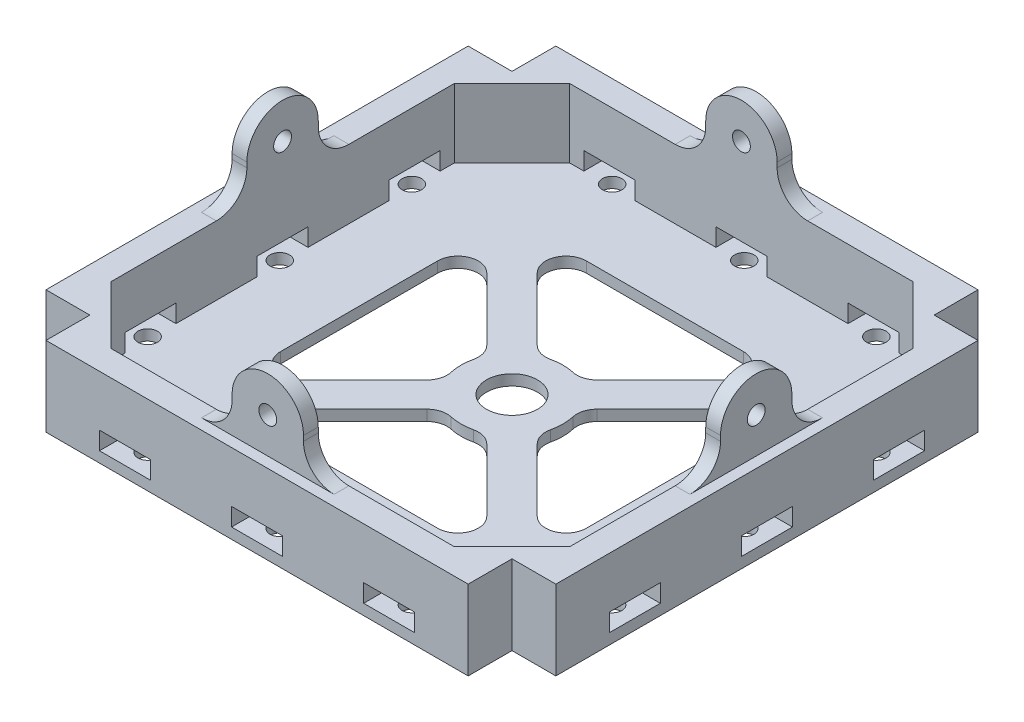
from build123d import *

# Parameters (mm, degrees)
SKETCH1_R              = 5
BOSS_EXTRUDE1_DEPTH    = 2.1
BOSS_EXTRUDE2_DEPTH    = 13.5
CUT_EXTRUDE2_START     = -0.5
CUT_EXTRUDE2_OUTLINE_W = 2.116666667
CUT_EXTRUDE2_OUTLINE_H = 1.838157895
CUT_EXTRUDE2_DEPTH     = 0.5
SKETCH5_R              = 1.75
BOSS_EXTRUDE3_DEPTH    = 2.9
CIRPATTERN37_COUNT     = 4
SKETCH6_R              = 1.905
CUT_EXTRUDE3_DEPTH     = 4
CUT_EXTRUDE4_DEPTH     = 10
CIRPATTERN39_COUNT     = 4


# Read off the part's stored shape, not the designer's step: Cut-Extrude2
with BuildPart() as part:
    # Sketch1 → Boss-Extrude1 (new body)
    with BuildSketch(Plane(origin=(0, 0, 0), x_dir=(1, 0, 0), z_dir=(0, 1, 0))):
        Polygon((-50, 41.4), (-50, -41.4), (-41.4, -41.4), (-41.4, -50), (41.4, -50), (41.4, -41.4), (50, -41.4), (50, 41.4), (41.4, 41.4), (41.4, 50), (-41.4, 50), (-41.4, 41.4), align=None)
        with BuildLine():
            ThreePointArc((-15.393398282, -30), (-19.088916412, -27.530733729), (-18.221825407, -23.171572875))
            Line((-18.221825407, -23.171572875), (-5.884253014, -10.834000483))
            ThreePointArc((-5.884253014, -10.834000483), (-4.171534398, -9.821178524), (-2.182732778, -9.758876863))
            ThreePointArc((-2.182732778, -9.758876863), (0, -10), (2.182732778, -9.758876863))
            ThreePointArc((2.182732778, -9.758876863), (4.171534398, -9.821178524), (5.884253014, -10.834000483))
            Line((5.884253014, -10.834000483), (18.221825407, -23.171572875))
            ThreePointArc((18.221825407, -23.171572875), (19.088916412, -27.530733729), (15.393398282, -30))
            Line((15.393398282, -30), (-15.393398282, -30))
        make_face(mode=Mode.SUBTRACT)
        with BuildLine():
            Line((-10.834000483, -5.884253014), (-23.171572875, -18.221825407))
            ThreePointArc((-23.171572875, -18.221825407), (-27.530733729, -19.088916412), (-30, -15.393398282))
            Line((-30, -15.393398282), (-30, 15.393398282))
            ThreePointArc((-30, 15.393398282), (-27.530733729, 19.088916412), (-23.171572875, 18.221825407))
            Line((-23.171572875, 18.221825407), (-10.834000483, 5.884253014))
            ThreePointArc((-10.834000483, 5.884253014), (-9.821178524, 4.171534398), (-9.758876863, 2.182732778))
            ThreePointArc((-9.758876863, 2.182732778), (-10, 0), (-9.758876863, -2.182732778))
            ThreePointArc((-9.758876863, -2.182732778), (-9.821178524, -4.171534398), (-10.834000483, -5.884253014))
        make_face(mode=Mode.SUBTRACT)
        with Locations(Location((0, 0, 0), (0, 0, 270))):
            Circle(SKETCH1_R, mode=Mode.SUBTRACT)
        with BuildLine():
            ThreePointArc((30, -15.393398282), (27.530733729, -19.088916412), (23.171572875, -18.221825407))
            Line((23.171572875, -18.221825407), (10.834000483, -5.884253014))
            ThreePointArc((10.834000483, -5.884253014), (9.821178524, -4.171534398), (9.758876863, -2.182732778))
            ThreePointArc((9.758876863, -2.182732778), (10, 0), (9.758876863, 2.182732778))
            ThreePointArc((9.758876863, 2.182732778), (9.821178524, 4.171534398), (10.834000483, 5.884253014))
            Line((10.834000483, 5.884253014), (23.171572875, 18.221825407))
            ThreePointArc((23.171572875, 18.221825407), (27.530733729, 19.088916412), (30, 15.393398282))
            Line((30, 15.393398282), (30, -15.393398282))
        make_face(mode=Mode.SUBTRACT)
        with BuildLine():
            Line((-5.884253014, 10.834000483), (-18.221825407, 23.171572875))
            ThreePointArc((-18.221825407, 23.171572875), (-19.088916412, 27.530733729), (-15.393398282, 30))
            Line((-15.393398282, 30), (15.393398282, 30))
            ThreePointArc((15.393398282, 30), (19.088916412, 27.530733729), (18.221825407, 23.171572875))
            Line((18.221825407, 23.171572875), (5.884253014, 10.834000483))
            ThreePointArc((5.884253014, 10.834000483), (4.171534398, 9.821178524), (2.182732778, 9.758876863))
            ThreePointArc((2.182732778, 9.758876863), (0, 10), (-2.182732778, 9.758876863))
            ThreePointArc((-2.182732778, 9.758876863), (-4.171534398, 9.821178524), (-5.884253014, 10.834000483))
        make_face(mode=Mode.SUBTRACT)
    extrude(amount=BOSS_EXTRUDE1_DEPTH)

    # Sketch2 → Boss-Extrude2 (add)
    with BuildSketch(Plane(origin=(0, 2.1, 0), x_dir=(1, 0, 0), z_dir=(0, 1, 0))):
        Polygon((-50, -41.4), (-41.4, -41.4), (-41.4, -50), (41.4, -50), (41.4, -41.4), (50, -41.4), (50, 41.4), (41.4, 41.4), (41.4, 50), (-41.4, 50), (-41.4, 41.4), (-50, 41.4), align=None)
        Polygon((-45, 33.686291501), (-45, -33.686291501), (-33.686291501, -45), (33.686291501, -45), (45, -33.686291501), (45, 33.686291501), (33.686291501, 45), (-33.686291501, 45), align=None, mode=Mode.SUBTRACT)
    extrude(amount=BOSS_EXTRUDE2_DEPTH)

    # Cut-Extrude2 outline → Cut-Extrude2 (cut)
    # profile 1 of 17: a face of its own
    with BuildSketch(Plane.XZ.offset(CUT_EXTRUDE2_START)):
        with BuildLine():
            add(Edge.make_bspline(
                [(40.707536165, 36.609129994), (40.742948557, 36.608681903), (40.811254877, 36.60781759), (40.910038544, 36.599727141), (41.00156458, 36.587480132), (41.085368307, 36.567654857), (41.162507675, 36.545144743), (41.231276113, 36.515075245), (41.293413313, 36.481278083), (41.347685137, 36.440921464), (41.394891306, 36.395189708), (41.436326199, 36.345164309), (41.471564766, 36.290098143), (41.49903923, 36.229111498), (41.522142744, 36.1637993), (41.537600516, 36.092767422), (41.545930404, 36.016919254), (41.54748678, 35.964808143), (41.54828452, 35.938097921)],
                knots=[0, 0, 0, 0, 0.086130676, 0.166135897, 0.240994725, 0.31050558, 0.375471466, 0.436172288, 0.492726909, 0.547213532, 0.600123186, 0.652264686, 0.704933723, 0.758614456, 0.81463812, 0.873200502, 0.935007284, 1, 1, 1, 1], degree=3))
            Line((40.707536165, 36.609129994), (38.094775748, 36.609129994))
            Line((38.094775748, 36.609129994), (38.094775748, 33.434129994))
            Line((38.094775748, 33.434129994), (38.986003819, 33.434129994))
            Line((38.986003819, 33.434129994), (38.986003819, 34.603866836))
            Line((38.986003819, 34.603866836), (39.515170485, 34.603866836))
            Line((39.515170485, 34.603866836), (40.728424323, 33.434129994))
            Line((40.728424323, 33.434129994), (41.868569608, 33.434129994))
            Line((41.868569608, 33.434129994), (40.436860452, 34.603866836))
            Line((40.436860452, 34.603866836), (40.707536165, 34.603866836))
            add(Edge.make_bspline(
                [(41.54828452, 35.280120948), (41.547477184, 35.253414311), (41.545902086, 35.201310193), (41.537705014, 35.125412414), (41.521800417, 35.054646363), (41.50025056, 34.988442683), (41.471168269, 34.927793741), (41.437400421, 34.871068229), (41.395942582, 34.820550924), (41.348613119, 34.774582115), (41.293787261, 34.734624044), (41.232707847, 34.69837418), (41.163519698, 34.669086682), (41.08664814, 34.645792608), (41.002595316, 34.626836307), (40.910726092, 34.612841236), (40.811524997, 34.605318571), (40.742942037, 34.604361119), (40.707536165, 34.603866836)],
                knots=[0, 0, 0, 0, 0.064798019, 0.126419647, 0.184806595, 0.240435923, 0.294891323, 0.347628395, 0.400158507, 0.45290966, 0.507233058, 0.564316447, 0.624835429, 0.68893432, 0.758923, 0.833660334, 0.914127344, 1, 1, 1, 1], degree=3))
            Line((41.54828452, 35.280120948), (41.54828452, 35.938097921))
        make_face()
        with BuildLine():
            add(Edge.make_bspline(
                [(40.65705645, 35.776214698), (40.656737125, 35.790777229), (40.656148762, 35.817609025), (40.647454631, 35.854420934), (40.632927735, 35.884366884), (40.609805217, 35.907462899), (40.576630571, 35.923224366), (40.531780225, 35.934069894), (40.473226695, 35.938993618), (40.429610834, 35.940098743), (40.405528215, 35.940708941)],
                knots=[0, 0, 0, 0, 0.123742076, 0.227997588, 0.319702305, 0.403550421, 0.500778739, 0.628405384, 0.794823007, 1, 1, 1, 1], degree=3))
            Line((40.65705645, 35.776214698), (40.65705645, 35.439393152))
            add(Edge.make_bspline(
                [(40.405528215, 35.272287889), (40.429593671, 35.272938271), (40.47346666, 35.274123964), (40.532495661, 35.278655651), (40.57706232, 35.290215419), (40.611260333, 35.304188234), (40.632525866, 35.329021557), (40.647914037, 35.358939993), (40.655957041, 35.396934649), (40.656672598, 35.424568996), (40.65705645, 35.439393152)],
                knots=[0, 0, 0, 0, 0.203407819, 0.370826509, 0.497352672, 0.592647424, 0.675844671, 0.766758648, 0.874880125, 1, 1, 1, 1], degree=3))
            Line((40.405528215, 35.272287889), (38.986003819, 35.272287889))
            Line((38.986003819, 35.272287889), (38.986003819, 35.940708941))
            Line((38.986003819, 35.940708941), (40.405528215, 35.940708941))
        make_face(mode=Mode.SUBTRACT)
    # profile 2 of 17: a face of its own
    with BuildSketch(Plane.XZ.offset(CUT_EXTRUDE2_START)):
        with BuildLine():
            add(Edge.make_bspline(
                [(27.729027393, 36.609129994), (27.764439798, 36.608681916), (27.832746141, 36.607817626), (27.931529644, 36.599727012), (28.023056242, 36.587480568), (28.106858081, 36.567653396), (28.184003812, 36.545149673), (28.252750804, 36.515058636), (28.31496084, 36.481334628), (28.368816271, 36.440841641), (28.416977702, 36.396038427), (28.457517698, 36.345188371), (28.492860337, 36.29031783), (28.520737096, 36.22978314), (28.543605582, 36.16465604), (28.559015396, 36.093921461), (28.567471188, 36.018375472), (28.568991936, 35.966550072), (28.569775748, 35.939838601)],
                knots=[0, 0, 0, 0, 0.086241168, 0.166349021, 0.241303881, 0.310903906, 0.375953133, 0.436731824, 0.493358995, 0.547915515, 0.600405328, 0.653160866, 0.705897468, 0.759006805, 0.815102337, 0.873739845, 0.934923909, 1, 1, 1, 1], degree=3))
            Line((27.729027393, 36.609129994), (25.116266976, 36.609129994))
            Line((25.116266976, 36.609129994), (25.116266976, 33.434129994))
            Line((25.116266976, 33.434129994), (26.007495047, 33.434129994))
            Line((26.007495047, 33.434129994), (26.007495047, 34.65956859))
            Line((26.007495047, 34.65956859), (27.729027393, 34.65956859))
            add(Edge.make_bspline(
                [(28.569775748, 35.328859983), (28.568982444, 35.302152092), (28.567443282, 35.250333639), (28.559117487, 35.174738612), (28.543266948, 35.104269269), (28.521928984, 35.038252548), (28.492627162, 34.978269717), (28.458919527, 34.922342144), (28.417116682, 34.872761768), (28.370385718, 34.826731611), (28.315188574, 34.787763525), (28.254167574, 34.752292545), (28.18458069, 34.723905754), (28.107783283, 34.700928872), (28.023909903, 34.681256661), (27.932119263, 34.66890516), (27.833031732, 34.660918741), (27.764438545, 34.660028286), (27.729027393, 34.65956859)],
                knots=[0, 0, 0, 0, 0.065034673, 0.126179797, 0.184779985, 0.240612481, 0.294628799, 0.346956687, 0.399131849, 0.452075659, 0.506179624, 0.563117822, 0.623582121, 0.688589947, 0.758145676, 0.83305283, 0.913813721, 1, 1, 1, 1], degree=3))
            Line((28.569775748, 35.328859983), (28.569775748, 35.939838601))
        make_face()
        with BuildLine():
            add(Edge.make_bspline(
                [(27.678547678, 35.781436737), (27.678241829, 35.795423283), (27.677679937, 35.821118676), (27.668827883, 35.856479513), (27.654161527, 35.885395324), (27.631305844, 35.908285468), (27.597987551, 35.924489422), (27.552710568, 35.933196994), (27.494568901, 35.940669701), (27.45113763, 35.940694931), (27.427019444, 35.940708941)],
                knots=[0, 0, 0, 0, 0.120297595, 0.221004821, 0.31164098, 0.396538571, 0.494983838, 0.626034827, 0.792330237, 1, 1, 1, 1], degree=3))
            Line((27.678547678, 35.781436737), (27.678547678, 35.489872867))
            add(Edge.make_bspline(
                [(27.427019444, 35.327989643), (27.451118203, 35.328077531), (27.495090919, 35.328237899), (27.553729926, 35.335039572), (27.598742953, 35.344756521), (27.632372322, 35.359136512), (27.654323364, 35.382979756), (27.669004633, 35.412471874), (27.677557158, 35.44908462), (27.6782013, 35.475609514), (27.678547678, 35.489872867)],
                knots=[0, 0, 0, 0, 0.205770203, 0.375466415, 0.502907386, 0.599343852, 0.681731003, 0.773734207, 0.878329059, 1, 1, 1, 1], degree=3))
            Line((27.427019444, 35.327989643), (26.007495047, 35.327989643))
            Line((26.007495047, 35.327989643), (26.007495047, 35.940708941))
            Line((26.007495047, 35.940708941), (27.427019444, 35.940708941))
        make_face(mode=Mode.SUBTRACT)
    # profile 3 of 17: a face of its own
    with BuildSketch(Plane.XZ.offset(CUT_EXTRUDE2_START)):
        with BuildLine():
            add(Edge.make_bspline(
                [(17.325854422, 36.609129994), (17.39754872, 36.607693096), (17.536850055, 36.604901218), (17.739462875, 36.58622298), (17.928991739, 36.552701165), (18.106255703, 36.508588584), (18.270220582, 36.448832077), (18.421241268, 36.37657842), (18.560269514, 36.292098822), (18.684824616, 36.193329382), (18.795592856, 36.083192421), (18.893023146, 35.963814195), (18.974744528, 35.83366212), (19.040430623, 35.69363776), (19.093776055, 35.544676766), (19.129209266, 35.385011661), (19.152908, 35.216138217), (19.155073634, 35.100046076), (19.156179257, 35.040777472)],
                knots=[0, 0, 0, 0, 0.078637394, 0.152791702, 0.222892515, 0.289573351, 0.352889383, 0.413946259, 0.472940987, 0.530936077, 0.587862435, 0.643969151, 0.699589206, 0.755953396, 0.813318286, 0.872753321, 0.935036661, 1, 1, 1, 1], degree=3))
            Line((17.325854422, 36.609129994), (15.312758204, 36.609129994))
            Line((15.312758204, 36.609129994), (15.312758204, 33.434129994))
            Line((15.312758204, 33.434129994), (17.1465644, 33.434129994))
            add(Edge.make_bspline(
                [(18.439889509, 33.679565849), (18.405452123, 33.659688466), (18.333605384, 33.618218268), (18.213254679, 33.568140977), (18.077957459, 33.52738333), (17.927766035, 33.492192171), (17.760288305, 33.46523272), (17.5732943, 33.448412156), (17.366653478, 33.435291206), (17.222018551, 33.434528098), (17.1465644, 33.434129994)],
                knots=[0, 0, 0, 0, 0.089478027, 0.186678065, 0.292692126, 0.407430982, 0.533853899, 0.674342509, 0.830108744, 1, 1, 1, 1], degree=3))
            add(Edge.make_bspline(
                [(19.156179257, 35.040777472), (19.153990895, 34.970731636), (19.14967987, 34.832742843), (19.11602404, 34.630750861), (19.060058291, 34.43814651), (18.994433379, 34.286363358), (18.93203305, 34.170797873), (18.878455869, 34.088676886), (18.81943018, 34.01043218), (18.75452897, 33.93632445), (18.685042553, 33.865352991), (18.608687803, 33.799281545), (18.527262114, 33.736400933), (18.469172992, 33.698614488), (18.439889509, 33.679565849)],
                knots=[0, 0, 0, 0, 0.130485059, 0.257052765, 0.380406524, 0.503432845, 0.564401295, 0.624984992, 0.685970219, 0.746900303, 0.808450873, 0.870906577, 0.934922325, 1, 1, 1, 1], degree=3))
        make_face()
        with BuildLine():
            add(Edge.make_bspline(
                [(18.264951187, 35.037296112), (18.264407797, 35.073593687), (18.263352925, 35.14405738), (18.251649755, 35.246187678), (18.233598534, 35.341403865), (18.208709181, 35.429987451), (18.175342014, 35.511236361), (18.135407569, 35.586080583), (18.087103034, 35.65335335), (18.031980535, 35.71394176), (17.969292688, 35.767494915), (17.899759189, 35.814707583), (17.822309709, 35.853681248), (17.738233287, 35.886433773), (17.646308249, 35.909880653), (17.547859126, 35.928629516), (17.442111916, 35.938769446), (17.369390761, 35.940049727), (17.331946801, 35.940708941)],
                knots=[0, 0, 0, 0, 0.073130483, 0.141966615, 0.206875894, 0.26832139, 0.327067122, 0.38358201, 0.438913801, 0.493549098, 0.548284436, 0.604723646, 0.662518775, 0.722679299, 0.786223035, 0.853430512, 0.924531698, 1, 1, 1, 1], degree=3))
            add(Edge.make_bspline(
                [(16.995995595, 34.102551046), (17.05258854, 34.103128493), (17.161236562, 34.104237082), (17.317744408, 34.115143149), (17.461112264, 34.130848868), (17.591449045, 34.154187739), (17.708606884, 34.184256237), (17.812449459, 34.221379825), (17.903505121, 34.264974288), (17.982301687, 34.315727268), (18.050032862, 34.375325113), (18.107372807, 34.443813438), (18.157168379, 34.520679948), (18.196782947, 34.606965735), (18.22704273, 34.70239674), (18.249784839, 34.806035514), (18.262595581, 34.91889865), (18.264148242, 34.996938477), (18.264951187, 35.037296112)],
                knots=[0, 0, 0, 0, 0.09295946, 0.178465026, 0.257626158, 0.32979831, 0.395807325, 0.45611371, 0.510683517, 0.561314739, 0.609603616, 0.658302373, 0.707615321, 0.759644995, 0.813754958, 0.871810098, 0.933707679, 1, 1, 1, 1], degree=3))
            Line((16.995995595, 34.102551046), (16.203986275, 34.102551046))
            Line((16.203986275, 34.102551046), (16.203986275, 35.940708941))
            Line((16.203986275, 35.940708941), (17.331946801, 35.940708941))
        make_face(mode=Mode.SUBTRACT)
    # profile 4 of 17: a face of its own
    with BuildSketch(Plane.XZ.offset(CUT_EXTRUDE2_START)):
        with BuildLine():
            add(Edge.make_bspline(
                [(-3.050543605, 34.790119577), (-3.028511607, 34.772404298), (-2.986389065, 34.738534805), (-2.926056525, 34.690519349), (-2.874901199, 34.645467975), (-2.843068805, 34.617467878), (-2.829035626, 34.604155544)],
                knots=[0, 0, 0, 0, 0.187363526, 0.358216641, 0.51086774, 0.639064081, 0.639064081, 0.639064081, 0.639064081], degree=3))
            Line((-3.050543605, 34.790119577), (-5.250762903, 36.609129994))
            Line((-5.250762903, 36.609129994), (-5.853908462, 36.609129994))
            Line((-5.853908462, 36.609129994), (-5.853908462, 33.434129994))
            Line((-5.853908462, 33.434129994), (-5.074083901, 33.434129994))
            Line((-5.074083901, 33.434129994), (-5.074083901, 35.145218261))
            add(Edge.make_bspline(
                [(-5.086185599, 35.424799165), (-5.08493275, 35.405014686), (-5.081797661, 35.345740488), (-5.076155437, 35.252629157), (-5.074738715, 35.179170914), (-5.074083901, 35.145218261)],
                knots=[0.352120927, 0.352120927, 0.352120927, 0.352120927, 0.489787436, 0.764177995, 1, 1, 1, 1], degree=3))
            add(Edge.make_bspline(
                [(-4.988790589, 35.339304062), (-5.01523155, 35.362641447), (-5.047773118, 35.391363366), (-5.080129973, 35.419502188), (-5.086185599, 35.424799165)],
                knots=[0, 0, 0, 0, 0.310608346, 0.382273666, 0.382273666, 0.382273666, 0.382273666], degree=3))
            Line((-4.988790589, 35.339304062), (-2.691963561, 33.434129994))
            Line((-2.691963561, 33.434129994), (-2.066189164, 33.434129994))
            Line((-2.066189164, 33.434129994), (-2.066189164, 36.609129994))
            Line((-2.066189164, 36.609129994), (-2.846013725, 36.609129994))
            Line((-2.846013725, 36.609129994), (-2.846013725, 34.945040082))
            add(Edge.make_bspline(
                [(-2.829035626, 34.604155544), (-2.830053816, 34.617984649), (-2.832788407, 34.655605168), (-2.837224925, 34.712915435), (-2.841739089, 34.78862502), (-2.844184793, 34.86466555), (-2.845465785, 34.9209602), (-2.846013725, 34.945040082)],
                knots=[0.28303234, 0.28303234, 0.28303234, 0.28303234, 0.370401488, 0.520692291, 0.645206251, 0.848237946, 1, 1, 1, 1], degree=3))
        make_face()
    # profile 5 of 17: a face of its own
    with BuildSketch(Plane.XZ.offset(CUT_EXTRUDE2_START)):
        with BuildLine():
            add(Edge.make_bspline(
                [(-12.431937519, 36.609129994), (-12.396525115, 36.608681916), (-12.328218771, 36.607817626), (-12.229435268, 36.599727012), (-12.13790867, 36.587480568), (-12.054106832, 36.567653396), (-11.976961101, 36.545149673), (-11.908214109, 36.515058636), (-11.846004072, 36.481334628), (-11.792148642, 36.440841641), (-11.743987211, 36.396038427), (-11.703447214, 36.345188371), (-11.668104575, 36.29031783), (-11.640227816, 36.22978314), (-11.61735933, 36.16465604), (-11.601949516, 36.093921461), (-11.593493724, 36.018375472), (-11.591972977, 35.966550072), (-11.591189164, 35.939838601)],
                knots=[0, 0, 0, 0, 0.086241168, 0.166349021, 0.241303881, 0.310903906, 0.375953133, 0.436731824, 0.493358995, 0.547915515, 0.600405328, 0.653160866, 0.705897468, 0.759006805, 0.815102337, 0.873739845, 0.934923909, 1, 1, 1, 1], degree=3))
            Line((-12.431937519, 36.609129994), (-15.044697936, 36.609129994))
            Line((-15.044697936, 36.609129994), (-15.044697936, 33.434129994))
            Line((-15.044697936, 33.434129994), (-14.153469866, 33.434129994))
            Line((-14.153469866, 33.434129994), (-14.153469866, 34.65956859))
            Line((-14.153469866, 34.65956859), (-12.431937519, 34.65956859))
            add(Edge.make_bspline(
                [(-11.591189164, 35.328859983), (-11.591982468, 35.302152092), (-11.593521631, 35.250333639), (-11.601847425, 35.174738612), (-11.617697964, 35.104269269), (-11.639035928, 35.038252548), (-11.66833775, 34.978269717), (-11.702045385, 34.922342144), (-11.74384823, 34.872761768), (-11.790579194, 34.826731611), (-11.845776339, 34.787763525), (-11.906797339, 34.752292545), (-11.976384222, 34.723905754), (-12.053181629, 34.700928872), (-12.137055009, 34.681256661), (-12.228845649, 34.66890516), (-12.327933181, 34.660918741), (-12.396526368, 34.660028286), (-12.431937519, 34.65956859)],
                knots=[0, 0, 0, 0, 0.065034673, 0.126179797, 0.184779985, 0.240612481, 0.294628799, 0.346956687, 0.399131849, 0.452075659, 0.506179624, 0.563117822, 0.623582121, 0.688589947, 0.758145676, 0.83305283, 0.913813721, 1, 1, 1, 1], degree=3))
            Line((-11.591189164, 35.328859983), (-11.591189164, 35.939838601))
        make_face()
        with BuildLine():
            add(Edge.make_bspline(
                [(-12.482417234, 35.781436737), (-12.482723084, 35.795423283), (-12.483284975, 35.821118676), (-12.49213703, 35.856479513), (-12.506803385, 35.885395324), (-12.529659069, 35.908285468), (-12.562977361, 35.924489422), (-12.608254344, 35.933196994), (-12.666396011, 35.940669701), (-12.709827282, 35.940694931), (-12.733945469, 35.940708941)],
                knots=[0, 0, 0, 0, 0.120297595, 0.221004821, 0.31164098, 0.396538571, 0.494983838, 0.626034827, 0.792330237, 1, 1, 1, 1], degree=3))
            Line((-12.482417234, 35.781436737), (-12.482417234, 35.489872867))
            add(Edge.make_bspline(
                [(-12.733945469, 35.327989643), (-12.709846709, 35.328077531), (-12.665873993, 35.328237899), (-12.607234986, 35.335039572), (-12.562221959, 35.344756521), (-12.52859259, 35.359136512), (-12.506641549, 35.382979756), (-12.49196028, 35.412471874), (-12.483407755, 35.44908462), (-12.482763612, 35.475609514), (-12.482417234, 35.489872867)],
                knots=[0, 0, 0, 0, 0.205770203, 0.375466415, 0.502907386, 0.599343852, 0.681731003, 0.773734207, 0.878329059, 1, 1, 1, 1], degree=3))
            Line((-12.733945469, 35.327989643), (-14.153469866, 35.327989643))
            Line((-14.153469866, 35.327989643), (-14.153469866, 35.940708941))
            Line((-14.153469866, 35.940708941), (-12.733945469, 35.940708941))
        make_face(mode=Mode.SUBTRACT)
    # profile 6 of 17: a face of its own
    with BuildSketch(Plane.XZ.offset(CUT_EXTRUDE2_START)):
        with BuildLine():
            add(Edge.make_bspline(
                [(-19.728867344, 36.609129994), (-19.693454951, 36.608681903), (-19.625148631, 36.60781759), (-19.526364964, 36.599727141), (-19.434838929, 36.587480132), (-19.351035202, 36.567654857), (-19.273895834, 36.545144743), (-19.205127396, 36.515075245), (-19.142990196, 36.481278083), (-19.088718372, 36.440921464), (-19.041512203, 36.395189708), (-19.00007731, 36.345164309), (-18.964838742, 36.290098143), (-18.937364279, 36.229111498), (-18.914260764, 36.1637993), (-18.898802992, 36.092767422), (-18.890473105, 36.016919254), (-18.888916729, 35.964808143), (-18.888118989, 35.938097921)],
                knots=[0, 0, 0, 0, 0.086130676, 0.166135897, 0.240994725, 0.31050558, 0.375471466, 0.436172288, 0.492726909, 0.547213532, 0.600123186, 0.652264686, 0.704933723, 0.758614456, 0.81463812, 0.873200502, 0.935007284, 1, 1, 1, 1], degree=3))
            Line((-19.728867344, 36.609129994), (-22.34162776, 36.609129994))
            Line((-22.34162776, 36.609129994), (-22.34162776, 33.434129994))
            Line((-22.34162776, 33.434129994), (-21.45039969, 33.434129994))
            Line((-21.45039969, 33.434129994), (-21.45039969, 34.603866836))
            Line((-21.45039969, 34.603866836), (-20.921233024, 34.603866836))
            Line((-20.921233024, 34.603866836), (-19.707979186, 33.434129994))
            Line((-19.707979186, 33.434129994), (-18.567833901, 33.434129994))
            Line((-18.567833901, 33.434129994), (-19.999543056, 34.603866836))
            Line((-19.999543056, 34.603866836), (-19.728867344, 34.603866836))
            add(Edge.make_bspline(
                [(-18.888118989, 35.280120948), (-18.888926325, 35.253414311), (-18.890501422, 35.201310193), (-18.898698495, 35.125412414), (-18.914603092, 35.054646363), (-18.936152949, 34.988442683), (-18.96523524, 34.927793741), (-18.999003088, 34.871068229), (-19.040460927, 34.820550924), (-19.08779039, 34.774582115), (-19.142616248, 34.734624044), (-19.203695662, 34.69837418), (-19.272883811, 34.669086682), (-19.349755369, 34.645792608), (-19.433808193, 34.626836307), (-19.525677417, 34.612841236), (-19.624878511, 34.605318571), (-19.693461472, 34.604361119), (-19.728867344, 34.603866836)],
                knots=[0, 0, 0, 0, 0.064798019, 0.126419647, 0.184806595, 0.240435923, 0.294891323, 0.347628395, 0.400158507, 0.45290966, 0.507233058, 0.564316447, 0.624835429, 0.68893432, 0.758923, 0.833660334, 0.914127344, 1, 1, 1, 1], degree=3))
            Line((-18.888118989, 35.280120948), (-18.888118989, 35.938097921))
        make_face()
        with BuildLine():
            add(Edge.make_bspline(
                [(-19.779347059, 35.776214698), (-19.779666383, 35.790777229), (-19.780254746, 35.817609025), (-19.788948877, 35.854420934), (-19.803475774, 35.884366884), (-19.826598292, 35.907462899), (-19.859772938, 35.923224366), (-19.904623284, 35.934069894), (-19.963176814, 35.938993618), (-20.006792675, 35.940098743), (-20.030875293, 35.940708941)],
                knots=[0, 0, 0, 0, 0.123742076, 0.227997588, 0.319702305, 0.403550421, 0.500778739, 0.628405384, 0.794823007, 1, 1, 1, 1], degree=3))
            Line((-19.779347059, 35.776214698), (-19.779347059, 35.439393152))
            add(Edge.make_bspline(
                [(-20.030875293, 35.272287889), (-20.006809838, 35.272938271), (-19.962936849, 35.274123964), (-19.903907848, 35.278655651), (-19.859341189, 35.290215419), (-19.825143176, 35.304188234), (-19.803877643, 35.329021557), (-19.788489472, 35.358939993), (-19.780446467, 35.396934649), (-19.779730911, 35.424568996), (-19.779347059, 35.439393152)],
                knots=[0, 0, 0, 0, 0.203407819, 0.370826509, 0.497352672, 0.592647424, 0.675844671, 0.766758648, 0.874880125, 1, 1, 1, 1], degree=3))
            Line((-20.030875293, 35.272287889), (-21.45039969, 35.272287889))
            Line((-21.45039969, 35.272287889), (-21.45039969, 35.940708941))
            Line((-21.45039969, 35.940708941), (-20.030875293, 35.940708941))
        make_face(mode=Mode.SUBTRACT)
    # profile 7 of 17: a face of its own
    with BuildSketch(Plane.XZ.offset(CUT_EXTRUDE2_START)):
        with BuildLine():
            add(Edge.make_bspline(
                [(-36.601276883, 35.818861353), (-36.600937383, 35.854570874), (-36.600284859, 35.92320512), (-36.59084536, 36.021926629), (-36.578651712, 36.11254583), (-36.559969905, 36.194639616), (-36.534109799, 36.267427296), (-36.504990361, 36.332802382), (-36.469466097, 36.38951763), (-36.427507152, 36.438405162), (-36.377059109, 36.478707467), (-36.319176008, 36.515280632), (-36.250642974, 36.543871013), (-36.173865893, 36.568563726), (-36.087387223, 36.586111226), (-35.992152611, 36.600255918), (-35.887135299, 36.607709253), (-35.814209339, 36.608643166), (-35.776194646, 36.609129994)],
                knots=[0, 0, 0, 0, 0.079570976, 0.152936638, 0.220892142, 0.283327182, 0.340187618, 0.392855116, 0.442556349, 0.488854897, 0.535723585, 0.585973001, 0.64100176, 0.700725093, 0.76554306, 0.837431554, 0.915256659, 1, 1, 1, 1], degree=3))
            Line((-36.601276883, 35.818861353), (-36.601276883, 34.195677417))
            add(Edge.make_bspline(
                [(-35.776194646, 33.434129994), (-35.814219902, 33.434546281), (-35.887166125, 33.43534487), (-35.991966303, 33.44371998), (-36.087870364, 33.454779306), (-36.174078597, 33.473574086), (-36.251517329, 33.495268606), (-36.318739623, 33.524287427), (-36.377227549, 33.557367081), (-36.427402548, 33.596141748), (-36.469203826, 33.643071015), (-36.504995697, 33.697292491), (-36.534317613, 33.760335424), (-36.559818916, 33.830937352), (-36.578601835, 33.910385647), (-36.590929259, 33.998106421), (-36.600277143, 34.09394064), (-36.600934525, 34.160837955), (-36.601276883, 34.195677417)],
                knots=[0, 0, 0, 0, 0.086162495, 0.165290898, 0.23820559, 0.304752134, 0.365089892, 0.42017571, 0.470253726, 0.517083573, 0.563173551, 0.612049957, 0.663813485, 0.720386283, 0.781947767, 0.84843906, 0.921068557, 1, 1, 1, 1], degree=3))
            Line((-35.776194646, 33.434129994), (-33.585549087, 33.434129994))
            add(Edge.make_bspline(
                [(-32.702154076, 34.195677417), (-32.702568987, 34.162296824), (-32.703371495, 34.097733031), (-32.711902704, 34.00487837), (-32.726867651, 33.919685765), (-32.746572955, 33.841763066), (-32.772131869, 33.771081861), (-32.804999461, 33.708617017), (-32.842207308, 33.653056921), (-32.886541846, 33.604824344), (-32.939802046, 33.564021766), (-33.001915456, 33.528166046), (-33.074687843, 33.498951339), (-33.157451376, 33.475959141), (-33.249881526, 33.45681016), (-33.35281262, 33.443045181), (-33.465908515, 33.435548922), (-33.544632109, 33.434615266), (-33.585549087, 33.434129994)],
                knots=[0, 0, 0, 0, 0.073171073, 0.141525405, 0.204162982, 0.262631517, 0.317571988, 0.36849603, 0.417011553, 0.463820965, 0.511406123, 0.563554777, 0.620604939, 0.682811522, 0.751670039, 0.827411202, 0.910296116, 1, 1, 1, 1], degree=3))
            Line((-32.702154076, 34.195677417), (-32.702154076, 35.818861353))
            add(Edge.make_bspline(
                [(-33.585549087, 36.609129994), (-33.544332145, 36.608777223), (-33.465567687, 36.608103088), (-33.352575496, 36.598975288), (-33.249511485, 36.585728589), (-33.156696154, 36.56582323), (-33.073853486, 36.541128861), (-33.001940001, 36.509407981), (-32.939092716, 36.473403207), (-32.886802444, 36.429532128), (-32.841861154, 36.37964043), (-32.805024525, 36.321463261), (-32.772332894, 36.256664681), (-32.746415736, 36.183819412), (-32.726801588, 36.103250186), (-32.71206337, 36.015428465), (-32.703293526, 35.919709356), (-32.702544363, 35.853404008), (-32.702154076, 35.818861353)],
                knots=[0, 0, 0, 0, 0.088901043, 0.169887484, 0.244422394, 0.312926052, 0.374499289, 0.430553572, 0.482187561, 0.530192301, 0.577182481, 0.626487656, 0.678273176, 0.733514295, 0.792871563, 0.85697914, 0.925491377, 1, 1, 1, 1], degree=3))
            Line((-33.585549087, 36.609129994), (-35.776194646, 36.609129994))
        make_face()
        with Locations((-34.651715479, 35.021629993)):
            Rectangle(CUT_EXTRUDE2_OUTLINE_W, CUT_EXTRUDE2_OUTLINE_H, mode=Mode.SUBTRACT)
    # profile 8 of 17: a face of its own
    with BuildSketch(Plane.XZ.offset(CUT_EXTRUDE2_START)):
        with BuildLine():
            add(Edge.make_bspline(
                [(-38.81368094, 35.383691397), (-38.773056581, 35.383202154), (-38.695206795, 35.382264601), (-38.583233338, 35.374868329), (-38.481654015, 35.360563053), (-38.389609845, 35.343379671), (-38.30838077, 35.318378473), (-38.23615196, 35.290628505), (-38.174521184, 35.255370586), (-38.121883595, 35.214768994), (-38.077648835, 35.167505498), (-38.039633226, 35.113725267), (-38.008755205, 35.052117605), (-37.982380833, 34.984016401), (-37.962744174, 34.908312383), (-37.948005779, 34.825706811), (-37.939303561, 34.735764533), (-37.93852301, 34.673513373), (-37.938118989, 34.641291452)],
                knots=[0, 0, 0, 0, 0.090676555, 0.17376644, 0.25023388, 0.319572191, 0.382463728, 0.439700641, 0.491907068, 0.54035162, 0.587533328, 0.63586089, 0.686831871, 0.740947088, 0.79859279, 0.86108637, 0.928096699, 1, 1, 1, 1], degree=3))
            Line((-38.81368094, 35.383691397), (-40.611803199, 35.383691397))
            Line((-40.611803199, 35.383691397), (-40.611803199, 35.940708941))
            Line((-40.611803199, 35.940708941), (-38.773645304, 35.940708941))
            Line((-38.773645304, 35.940708941), (-38.773645304, 35.606498415))
            Line((-38.773645304, 35.606498415), (-37.993820743, 35.769251978))
            Line((-37.993820743, 35.769251978), (-37.993820743, 35.865859709))
            add(Edge.make_bspline(
                [(-38.848494537, 36.609129994), (-38.809888646, 36.608763771), (-38.735760105, 36.608060572), (-38.629131927, 36.599000407), (-38.531662762, 36.585571327), (-38.443209791, 36.566396744), (-38.363573247, 36.542687745), (-38.293541194, 36.512108842), (-38.232293325, 36.476389164), (-38.180394024, 36.434058542), (-38.135910108, 36.385773074), (-38.097367268, 36.331505144), (-38.065054503, 36.269992359), (-38.039422257, 36.201685079), (-38.018199433, 36.12725067), (-38.003789254, 36.045906765), (-37.995006132, 35.958022137), (-37.99422402, 35.897213921), (-37.993820743, 35.865859709)],
                knots=[0, 0, 0, 0, 0.087778197, 0.168546033, 0.243195987, 0.311400298, 0.374221822, 0.431838005, 0.484796413, 0.534981681, 0.583540027, 0.633703602, 0.685946071, 0.74108733, 0.799364668, 0.861744577, 0.928712103, 1, 1, 1, 1], degree=3))
            Line((-38.848494537, 36.609129994), (-40.587433681, 36.609129994))
            add(Edge.make_bspline(
                [(-41.39162776, 35.815379994), (-41.391143614, 35.851364105), (-41.390217001, 35.92023441), (-41.382754646, 36.019471496), (-41.368430157, 36.109731906), (-41.35118564, 36.192252111), (-41.326061717, 36.265567135), (-41.29847139, 36.331572596), (-41.262803214, 36.387975168), (-41.222306277, 36.437082551), (-41.174034612, 36.479186893), (-41.116336786, 36.513891706), (-41.049840493, 36.543218794), (-40.974539826, 36.567421278), (-40.890632882, 36.58627737), (-40.79788122, 36.600255733), (-40.695770211, 36.60772211), (-40.624579615, 36.608647265), (-40.587433681, 36.609129994)],
                knots=[0, 0, 0, 0, 0.081107998, 0.155233303, 0.224039566, 0.287021894, 0.344921147, 0.398501503, 0.447852954, 0.494738473, 0.541550976, 0.591458141, 0.645901411, 0.705042809, 0.769445023, 0.839544171, 0.916277122, 1, 1, 1, 1], degree=3))
            Line((-41.39162776, 35.815379994), (-41.39162776, 35.468114369))
            add(Edge.make_bspline(
                [(-40.587433681, 34.715270345), (-40.624589087, 34.715685245), (-40.695797835, 34.716480405), (-40.797990699, 34.724850779), (-40.891295915, 34.735903848), (-40.975184774, 34.754749019), (-41.050410788, 34.776595213), (-41.116441194, 34.804631437), (-41.173631877, 34.837395264), (-41.222214397, 34.876728919), (-41.262817194, 34.923245916), (-41.297977552, 34.976702236), (-41.326564219, 35.039125698), (-41.350836388, 35.109001012), (-41.368541065, 35.187628464), (-41.382747602, 35.273582474), (-41.3902083, 35.368184436), (-41.391141332, 35.433869859), (-41.39162776, 35.468114369)],
                knots=[0, 0, 0, 0, 0.085843117, 0.16451929, 0.236870535, 0.302757177, 0.362994662, 0.417665336, 0.468146515, 0.514848641, 0.561396507, 0.610303717, 0.662190103, 0.719650967, 0.780960971, 0.848198305, 0.920859539, 1, 1, 1, 1], degree=3))
            Line((-40.587433681, 34.715270345), (-38.71794355, 34.715270345))
            Line((-38.71794355, 34.715270345), (-38.71794355, 34.102551046))
            Line((-38.71794355, 34.102551046), (-40.723206708, 34.102551046))
            Line((-40.723206708, 34.102551046), (-40.723206708, 34.492463327))
            Line((-40.723206708, 34.492463327), (-41.503031269, 34.341024182))
            Line((-41.503031269, 34.341024182), (-41.503031269, 34.206121496))
            add(Edge.make_bspline(
                [(-40.70579991, 33.434129994), (-40.742660412, 33.434579482), (-40.813280538, 33.435440645), (-40.914708499, 33.443353381), (-41.006969649, 33.455944659), (-41.090484316, 33.474339166), (-41.165115162, 33.49706248), (-41.230584556, 33.526042179), (-41.28692446, 33.560043177), (-41.335423301, 33.599687494), (-41.375288558, 33.647807644), (-41.410215701, 33.70258795), (-41.438909056, 33.766326771), (-41.46194367, 33.838277772), (-41.481322132, 33.91817791), (-41.493776148, 34.006781002), (-41.501718888, 34.103564104), (-41.502581836, 34.171000101), (-41.503031269, 34.206121496)],
                knots=[0, 0, 0, 0, 0.084525479, 0.161940279, 0.233172099, 0.297908124, 0.357883706, 0.411795049, 0.46166225, 0.508432556, 0.554693672, 0.604347346, 0.65704611, 0.71448795, 0.77742781, 0.8453672, 0.919465569, 1, 1, 1, 1], degree=3))
            Line((-40.70579991, 33.434129994), (-38.81368094, 33.434129994))
            add(Edge.make_bspline(
                [(-37.938118989, 34.206121496), (-37.938538946, 34.172452947), (-37.93935144, 34.107314254), (-37.947847792, 34.013280777), (-37.963101999, 33.927104616), (-37.981157781, 33.847912532), (-38.00774112, 33.777274983), (-38.038972561, 33.713589806), (-38.076518261, 33.657753782), (-38.119783699, 33.608386704), (-38.171954065, 33.566510994), (-38.233723257, 33.530985712), (-38.305543974, 33.500379507), (-38.387935098, 33.477107057), (-38.479542911, 33.456174539), (-38.581957304, 33.444624574), (-38.694264729, 33.435074483), (-38.772748963, 33.434453734), (-38.81368094, 33.434129994)],
                knots=[0, 0, 0, 0, 0.073716556, 0.142619752, 0.206432499, 0.265290663, 0.320163874, 0.371302536, 0.420284679, 0.467079927, 0.514504822, 0.566040478, 0.622679807, 0.684988608, 0.753274037, 0.828209579, 0.910405934, 1, 1, 1, 1], degree=3))
            Line((-37.938118989, 34.206121496), (-37.938118989, 34.641291452))
        make_face()
    # profile 9 of 17: a face of its own
    with BuildSketch(Plane.XZ.offset(CUT_EXTRUDE2_START)):
        Polygon((33.471530134, 33.434129994), (36.813635397, 33.434129994), (36.813635397, 34.102551046), (34.362758204, 34.102551046), (34.362758204, 34.770972099), (35.755302064, 34.770972099), (35.755302064, 35.439393152), (34.362758204, 35.439393152), (34.362758204, 35.940708941), (36.757933643, 35.940708941), (36.757933643, 36.609129994), (33.471530134, 36.609129994), align=None)
    # profile 10 of 17: a face of its own
    with BuildSketch(Plane.XZ.offset(CUT_EXTRUDE2_START)):
        Polygon((30.352231889, 33.434129994), (31.243459959, 33.434129994), (31.243459959, 35.940708941), (32.636003819, 35.940708941), (32.636003819, 36.609129994), (28.959688029, 36.609129994), (28.959688029, 35.940708941), (30.352231889, 35.940708941), align=None)
    # profile 11 of 17: a face of its own
    with BuildSketch(Plane.XZ.offset(CUT_EXTRUDE2_START)):
        Polygon((19.880302064, 33.434129994), (20.728013139, 33.434129994), (21.084852503, 34.102551046), (22.911695979, 34.102551046), (23.279849761, 33.434129994), (24.225038906, 33.434129994), (22.435620047, 36.609129994), (21.637518347, 36.609129994), align=None)
        Polygon((21.419063029, 34.770972099), (22.010894169, 35.904154665), (22.594021911, 34.770972099), align=None, mode=Mode.SUBTRACT)
    # profile 12 of 17: a face of its own
    with BuildSketch(Plane.XZ.offset(CUT_EXTRUDE2_START)):
        Polygon((10.076793292, 33.434129994), (10.924504367, 33.434129994), (11.281343731, 34.102551046), (13.108187207, 34.102551046), (13.47634099, 33.434129994), (14.421530134, 33.434129994), (12.632111275, 36.609129994), (11.834009575, 36.609129994), align=None)
        Polygon((12.790513139, 34.770972099), (11.615554257, 34.770972099), (12.207385397, 35.904154665), align=None, mode=Mode.SUBTRACT)
    # profile 13 of 17: a face of its own
    with BuildSketch(Plane.XZ.offset(CUT_EXTRUDE2_START)):
        Polygon((4.061003819, 33.434129994), (7.236003819, 33.434129994), (7.236003819, 34.102551046), (4.952231889, 34.102551046), (4.952231889, 36.609129994), (4.061003819, 36.609129994), align=None)
    # profile 14 of 17: a face of its own
    with BuildSketch(Plane.XZ.offset(CUT_EXTRUDE2_START)):
        Polygon((-0.562241796, 33.434129994), (2.779863468, 33.434129994), (2.779863468, 34.102551046), (0.328986275, 34.102551046), (0.328986275, 34.770972099), (1.721530134, 34.770972099), (1.721530134, 35.439393152), (0.328986275, 35.439393152), (0.328986275, 35.940708941), (2.724161713, 35.940708941), (2.724161713, 36.609129994), (-0.562241796, 36.609129994), align=None)
    # profile 15 of 17: a face of its own
    with BuildSketch(Plane.XZ.offset(CUT_EXTRUDE2_START)):
        Polygon((-11.089873374, 33.434129994), (-10.2421623, 33.434129994), (-9.885322936, 34.102551046), (-8.05847946, 34.102551046), (-7.690325677, 33.434129994), (-6.745136532, 33.434129994), (-8.534555392, 36.609129994), (-9.332657092, 36.609129994), align=None)
        Polygon((-8.376153528, 34.770972099), (-9.55111241, 34.770972099), (-8.959281269, 35.904154665), align=None, mode=Mode.SUBTRACT)
    # profile 16 of 17: a face of its own
    with BuildSketch(Plane.XZ.offset(CUT_EXTRUDE2_START)):
        Polygon((-27.577592673, 33.434129994), (-26.729881598, 33.434129994), (-26.373042234, 34.102551046), (-24.546198758, 34.102551046), (-24.178044975, 33.434129994), (-23.232855831, 33.434129994), (-25.02227469, 36.609129994), (-25.82037639, 36.609129994), align=None)
        Polygon((-24.863872826, 34.770972099), (-26.038831708, 34.770972099), (-25.447000567, 35.904154665), align=None, mode=Mode.SUBTRACT)
    # profile 17 of 17: a face of its own
    with BuildSketch(Plane.XZ.offset(CUT_EXTRUDE2_START)):
        Polygon((-31.198206708, 33.434129994), (-28.023206708, 33.434129994), (-28.023206708, 34.102551046), (-30.306978638, 34.102551046), (-30.306978638, 36.609129994), (-31.198206708, 36.609129994), align=None)
    extrude(amount=CUT_EXTRUDE2_DEPTH, mode=Mode.SUBTRACT)

    # Sketch5 → Boss-Extrude3 (add)
    with BuildSketch(Plane(origin=(0, 0, 45), x_dir=(-1, 0, 0), z_dir=(0, 0, -1))):
        with BuildLine():
            ThreePointArc((7, 22.6), (0, 29.6), (-7, 22.6))
            Line((-7, 22.6), (-7, 21.6))
            ThreePointArc((-7, 21.6), (-8.757359313, 17.357359313), (-13, 15.6))
            Line((-13, 15.6), (6.064959061, 15.6))
            Line((6.064959061, 15.6), (13, 15.6))
            ThreePointArc((13, 15.6), (8.757359313, 17.357359313), (7, 21.6))
            Line((7, 21.6), (7, 22.6))
        make_face()
        with Locations((0, 22.6)):
            Circle(SKETCH5_R, mode=Mode.SUBTRACT)
    boss_extrude3 = extrude(amount=-BOSS_EXTRUDE3_DEPTH)

    # CirPattern37: Boss-Extrude3 ×4 about axis
    cirpattern37_axis = Axis((0, 0, 0), (0, 1, 0))
    for i in range(1, CIRPATTERN37_COUNT):
        add(boss_extrude3.rotate(cirpattern37_axis, i * 360 / CIRPATTERN37_COUNT))

    # Sketch6 → Cut-Extrude3 (cut)
    with BuildSketch(Plane.XZ):
        with Locations(Location((-45.555, 25.908, 0), (0, 0, 270))):
            Circle(SKETCH6_R)
        with Locations(Location((-45.555, 0, 0), (0, 0, 270))):
            Circle(SKETCH6_R)
        with Locations(Location((-45.555, -25.908, 0), (0, 0, 270))):
            Circle(SKETCH6_R)
    cut_extrude3 = extrude(amount=-CUT_EXTRUDE3_DEPTH, mode=Mode.SUBTRACT)

    # Sketch7 → Cut-Extrude4 (cut)
    with BuildSketch(Plane.ZY.offset(50)):
        Polygon((-30.908, 5.6), (-30.908, 2.1), (-27.730361106, 2.1), (-24.085638894, 2.1), (-20.908, 2.1), (-20.908, 5.6), align=None)
        Polygon((-5, 5.6), (-5, 2.1), (-1.822361106, 2.1), (1.822361106, 2.1), (5, 2.1), (5, 5.6), align=None)
        Polygon((20.908, 5.6), (20.908, 2.1), (24.085638894, 2.1), (27.730361106, 2.1), (30.908, 2.1), (30.908, 5.6), align=None)
    cut_extrude4 = extrude(amount=-CUT_EXTRUDE4_DEPTH, mode=Mode.SUBTRACT)

    # CirPattern39: Cut-Extrude3, Cut-Extrude4 ×4 about axis
    cirpattern39_axis = Axis((0, 0, 0), (0, 1, 0))
    add([cut_extrude3.rotate(cirpattern39_axis, i * 360 / CIRPATTERN39_COUNT) for i in range(1, CIRPATTERN39_COUNT)], mode=Mode.SUBTRACT)
    add([cut_extrude4.rotate(cirpattern39_axis, i * 360 / CIRPATTERN39_COUNT) for i in range(1, CIRPATTERN39_COUNT)], mode=Mode.SUBTRACT)


solid = part.part
